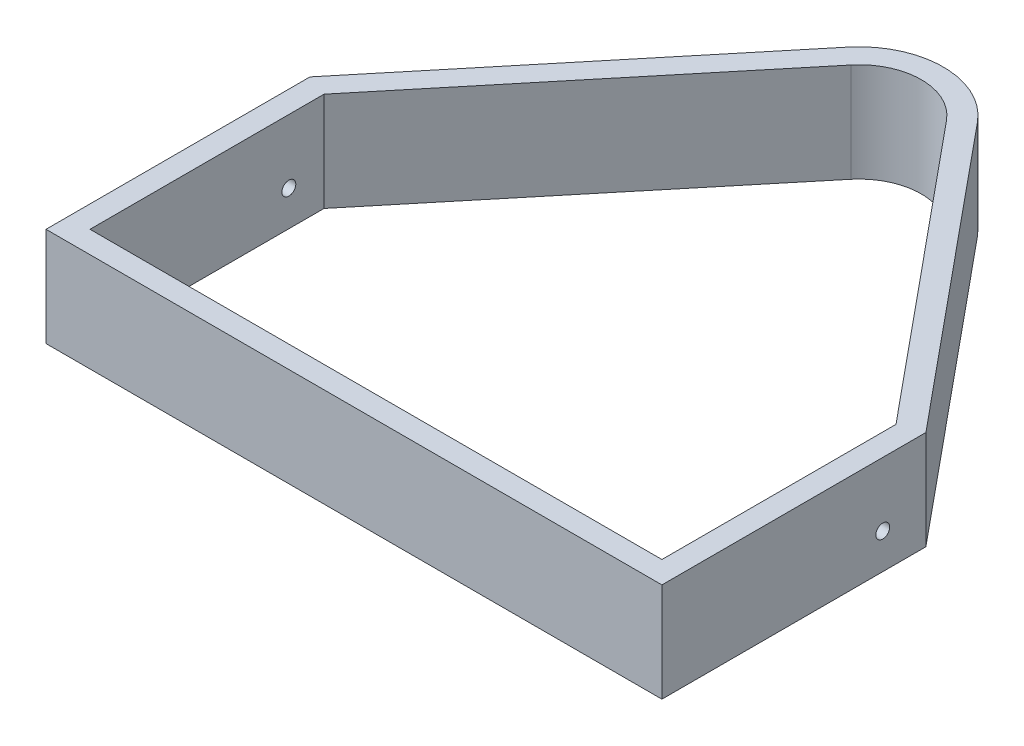
from build123d import *

# Parameters (mm, degrees)
BOSS_EXTRUDE1_DEPTH = 28.575
CUT_EXTRUDE1_REACH  = 278.603
CUT_EXTRUDE1_START  = -82.55
SKETCH2_R           = 2
CUT_EXTRUDE3_REACH  = 278.603
CUT_EXTRUDE3_START  = 82.55
SKETCH2_2_R         = 2


with BuildPart() as part:
    # Sketch1 → Boss-Extrude1 (new body)
    with BuildSketch(Plane(origin=(0, 0, 0), x_dir=(1, 0, 0), z_dir=(0, 1, 0))):
        with BuildLine():
            Line((-88.9, 0), (88.9, 0))
            Line((88.9, 0), (88.9, 76.2))
            Line((88.9, 76.2), (18.702682169, 161.291999073))
            ThreePointArc((18.702682169, 161.291999073), (0, 170.108527998), (-18.702682169, 161.291999073))
            Line((-18.702682169, 161.291999073), (-88.9, 76.2))
            Line((-88.9, 76.2), (-88.9, 0))
        make_face()
        with BuildLine():
            Line((-82.55, 6.35), (-82.55, 73.918790961))
            Line((-82.55, 73.918790961), (-13.804360649, 157.251089982))
            ThreePointArc((-13.804360649, 157.251089982), (0, 163.758527998), (13.804360649, 157.251089982))
            Line((13.804360649, 157.251089982), (82.55, 73.918790961))
            Line((82.55, 73.918790961), (82.55, 6.35))
            Line((82.55, 6.35), (-82.55, 6.35))
        make_face(mode=Mode.SUBTRACT)
    extrude(amount=BOSS_EXTRUDE1_DEPTH)

    # Sketch2 → Cut-Extrude1 (cut, up to next)
    with BuildSketch(Plane(origin=(0, 0, 0), x_dir=(0, 0, -1), z_dir=(1, 0, 0)).offset(CUT_EXTRUDE1_START), mode=Mode.PRIVATE) as cut_extrude1_sk1:
        with Locations((63.758790961, 10.16)):
            Circle(SKETCH2_R)
    cut_extrude1_tool1 = extrude(cut_extrude1_sk1.sketch, amount=-CUT_EXTRUDE1_REACH, mode=Mode.PRIVATE) & part.part
    add(cut_extrude1_tool1.solids().sort_by_distance((-82.55, 10.16, -63.758791))[0], mode=Mode.SUBTRACT)

    # Sketch2<2> → Cut-Extrude3 (cut, up to next)
    with BuildSketch(Plane(origin=(0, 0, 0), x_dir=(0, 0, -1), z_dir=(1, 0, 0)).offset(CUT_EXTRUDE3_START), mode=Mode.PRIVATE) as cut_extrude3_sk1:
        with Locations((63.758790961, 10.16)):
            Circle(SKETCH2_2_R)
    cut_extrude3_tool1 = extrude(cut_extrude3_sk1.sketch, amount=CUT_EXTRUDE3_REACH, mode=Mode.PRIVATE) & part.part
    add(cut_extrude3_tool1.solids().sort_by_distance((82.55, 10.16, -63.758791))[0], mode=Mode.SUBTRACT)


solid = part.part
